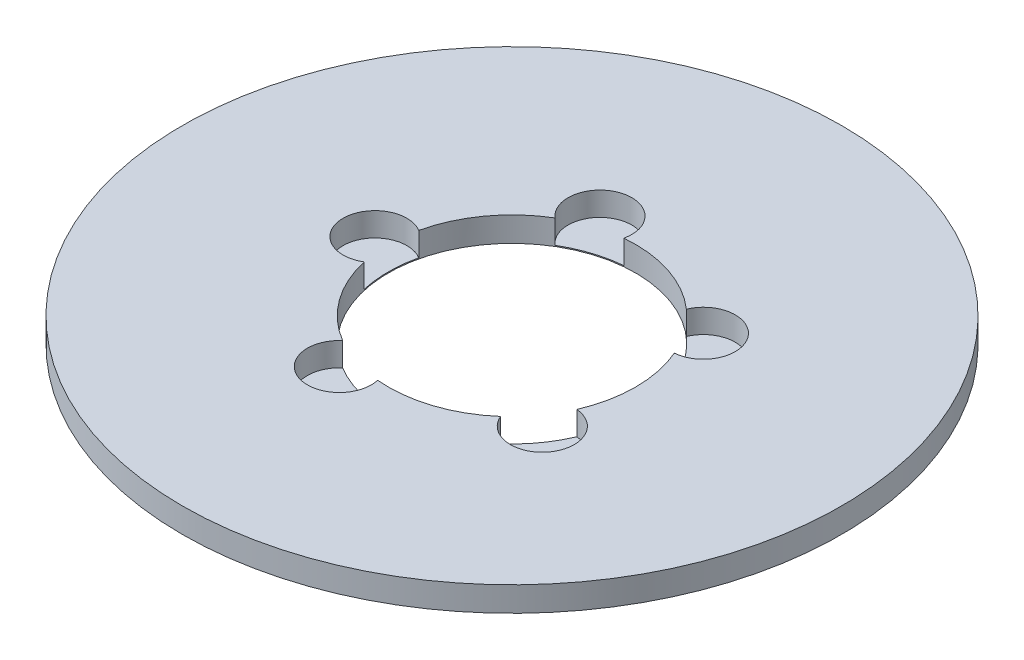
from build123d import *

# Parameters (mm, degrees)
SKETCH1_R           = 80
BOSS_EXTRUDE1_DEPTH = 6
SKETCH2_R           = 30
CUT_EXTRUDE1_DEPTH  = 114.296072306
SKETCH3_R           = 7.740535704
CUT_EXTRUDE2_DEPTH  = 5.755272714
CIRPATTERN1_COUNT   = 5


with BuildPart() as part:
    # Sketch1 → Boss-Extrude1 (new body)
    with BuildSketch(Plane(origin=(0, 0, 0), x_dir=(1, 0, 0), z_dir=(0, 1, 0))):
        Circle(SKETCH1_R)
    extrude(amount=BOSS_EXTRUDE1_DEPTH)

    # Sketch2 → Cut-Extrude1 (cut, through all)
    with BuildSketch(Plane(origin=(0, 0, 0), x_dir=(1, 0, 0), z_dir=(0, 1, 0))):
        Circle(SKETCH2_R)
    extrude(amount=CUT_EXTRUDE1_DEPTH, mode=Mode.SUBTRACT)

    # Sketch3 → Cut-Extrude2 (cut)
    with BuildSketch(Plane(origin=(0, 6, 0), x_dir=(1, 0, 0), z_dir=(0, 1, 0))):
        with Locations((-33.260820472, 0)):
            Circle(SKETCH3_R)
    cut_extrude2 = extrude(amount=-CUT_EXTRUDE2_DEPTH, mode=Mode.SUBTRACT)

    # CirPattern1: Cut-Extrude2 ×5 about axis
    cirpattern1_axis = Axis((0, 0, 0), (0, 1, 0))
    for i in range(1, CIRPATTERN1_COUNT):
        add(cut_extrude2.rotate(cirpattern1_axis, i * 360 / CIRPATTERN1_COUNT), mode=Mode.SUBTRACT)


solid = part.part
